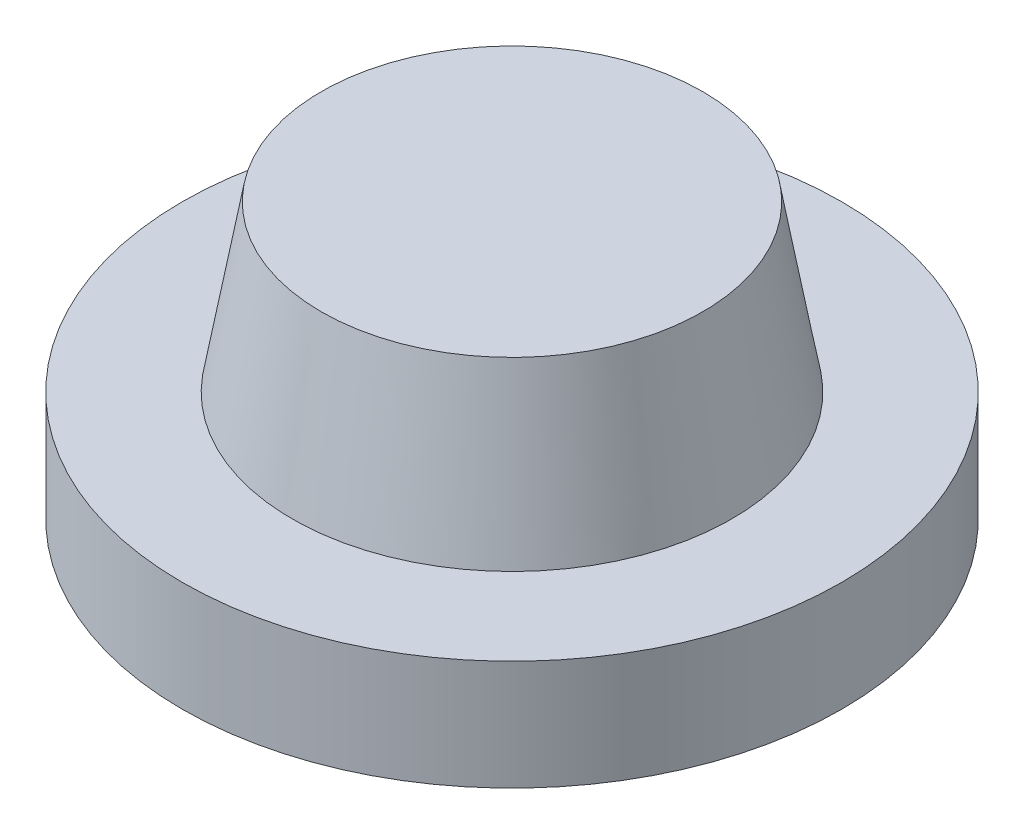
from build123d import *


with BuildPart() as part:
    # Sketch1 → Revolve1 (revolve)
    with BuildSketch(Plane.XY):
        Polygon((0, 1.275633966), (1.755607926, 1.275633966), (1.755607926, 0), (6, 0), (6, 2), (4, 2), (3.471019058, 5), (0, 5), align=None)
    revolve(axis=Axis((0, 0, 0), (0, 1, 0)))


solid = part.part
